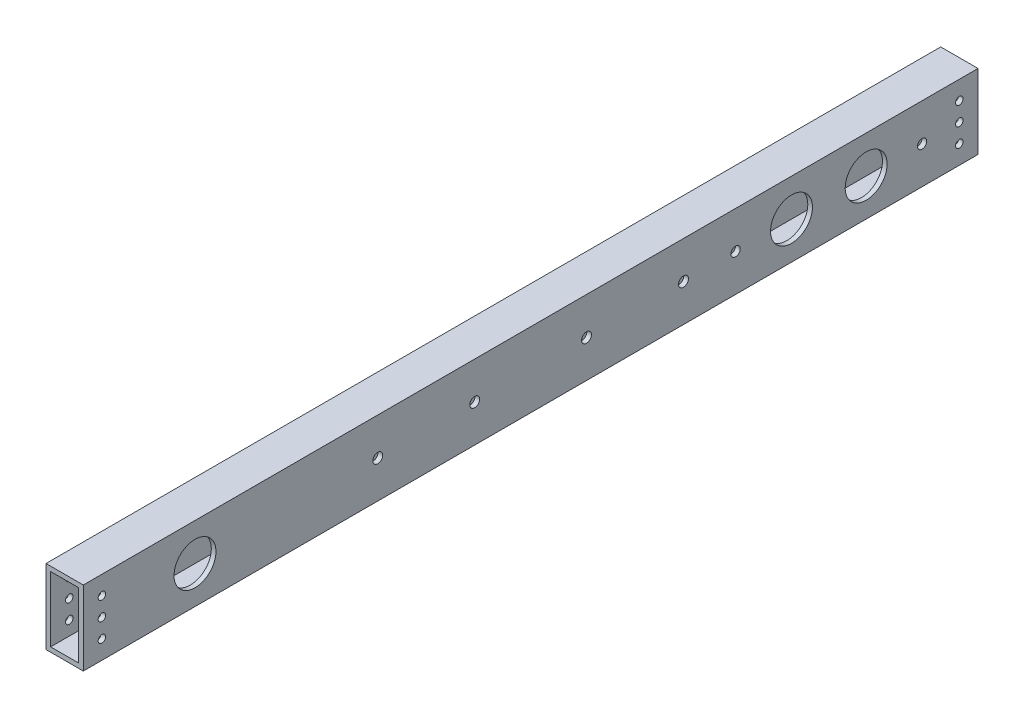
from build123d import *

# Parameters (mm, degrees)
SKETCH1_W               = 25.4
SKETCH1_H               = 50.8
SKETCH1_W_2             = 19.05
SKETCH1_H_2             = 44.45
BOSS_EXTRUDE1_DEPTH     = 304.8
F_10_CLEARANCE_HOLE1_D  = 5.1054
F_1_4_CLEARANCE_HOLE2_D = 6.7564
SKETCH7_R               = 14.2875
SKETCH7_R_2             = 3.175
CUT_EXTRUDE1_DEPTH      = 307.909367729


with BuildPart() as part:
    # Sketch1 → Boss-Extrude1 (new, symmetric)
    with BuildSketch(Plane.XY):
        Rectangle(SKETCH1_W, SKETCH1_H)
        Rectangle(SKETCH1_W_2, SKETCH1_H_2, mode=Mode.SUBTRACT)
    extrude(amount=BOSS_EXTRUDE1_DEPTH, both=True)

    # #10 Clearance Hole1 (through all)
    with Locations(Plane(origin=(12.7, 0, 0), x_dir=(0, 0, -1), z_dir=(1, 0, 0))):
        with Locations((-292.1, 12.7), (-292.1, 0), (-292.1, -12.7)):
            f_10_clearance_hole1 = Hole(F_10_CLEARANCE_HOLE1_D / 2)

    # Mirror1: #10 Clearance Hole1 across plane
    add(f_10_clearance_hole1.mirror(Plane.XY), mode=Mode.SUBTRACT)

    # 1/4 Clearance Hole2 (through all)
    with Locations(Plane(origin=(12.7, 0, 0), x_dir=(0, 0, -1), z_dir=(1, 0, 0))):
        with Locations((-38.1, 0), (38.1, 0), (-104.14, 0), (104.14, 0)):
            Hole(F_1_4_CLEARANCE_HOLE2_D / 2)

    # Sketch7 → Cut-Extrude1 (cut, through all)
    with BuildSketch(Plane(origin=(12.7, 0, 0), x_dir=(0, 0, -1), z_dir=(1, 0, 0))):
        with Locations((-228.6762, 0)):
            Circle(SKETCH7_R)
        with Locations((177.7238, 0)):
            Circle(SKETCH7_R)
        with Locations((228.6, 0)):
            Circle(SKETCH7_R)
        with Locations((139.6238, 0)):
            Circle(SKETCH7_R_2)
        with Locations((266.7, 0)):
            Circle(SKETCH7_R_2)
    extrude(amount=-CUT_EXTRUDE1_DEPTH, mode=Mode.SUBTRACT)


solid = part.part
